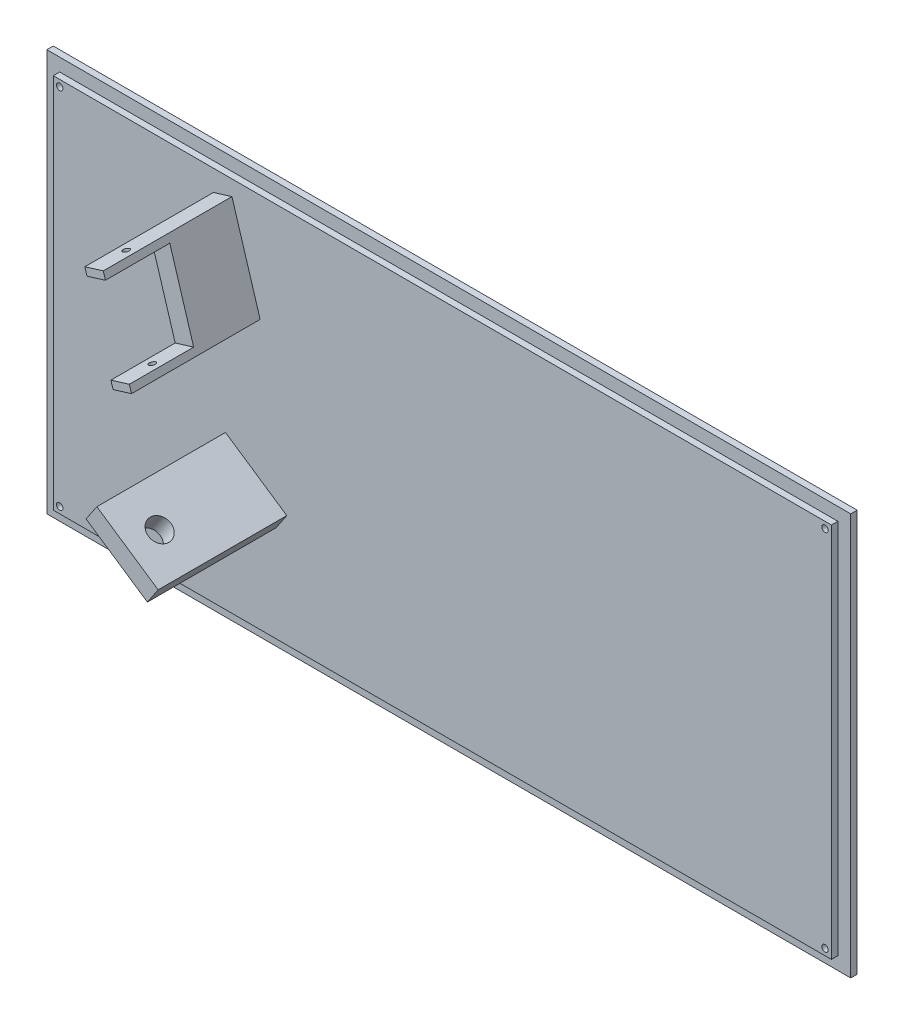
from build123d import *

# Parameters (mm, degrees)
SKIZZE1_W                       = 250
SKIZZE1_H                       = 125
AUFSATZ_LINEAR_AUSTRAGEN1_DEPTH = 2
SKIZZE2_W                       = 242
SKIZZE2_H                       = 117
AUFSATZ_LINEAR_AUSTRAGEN2_DEPTH = 2
SKIZZE3_R                       = 1
SCHNITT_LINEAR_AUSTRAGEN1_DEPTH = 32
AUFSATZ_LINEAR_AUSTRAGEN3_DEPTH = 40
SCHNITT_LINEAR_AUSTRAGEN2_DEPTH = 20
SKIZZE8_R                       = 1
SCHNITT_LINEAR_AUSTRAGEN3_DEPTH = 40
SKIZZE9_R                       = 3.493135661
SCHNITT_LINEAR_AUSTRAGEN4_DEPTH = 20


with BuildPart() as part:
    # Skizze1 → Aufsatz-Linear austragen1 (new body)
    with BuildSketch(Plane.XY):
        with Locations((125, 62.5)):
            Rectangle(SKIZZE1_W, SKIZZE1_H)
    extrude(amount=AUFSATZ_LINEAR_AUSTRAGEN1_DEPTH)

    # Skizze2 → Aufsatz-Linear austragen2 (add)
    with BuildSketch(Plane.XY.offset(2)):
        with Locations((125, 62.5)):
            Rectangle(SKIZZE2_W, SKIZZE2_H)
    extrude(amount=AUFSATZ_LINEAR_AUSTRAGEN2_DEPTH)

    # Skizze3 → Schnitt-Linear austragen1 (cut)
    with BuildSketch(Plane.XY.offset(4)):
        with Locations((6, 119)):
            Circle(SKIZZE3_R)
        with Locations((6, 6)):
            Circle(SKIZZE3_R)
        with Locations((244, 6)):
            Circle(SKIZZE3_R)
        with Locations((244, 119)):
            Circle(SKIZZE3_R)
    extrude(amount=-SCHNITT_LINEAR_AUSTRAGEN1_DEPTH, mode=Mode.SUBTRACT)

    # Skizze4 → Aufsatz-Linear austragen3 (add)
    with BuildSketch(Plane.XY.offset(4)):
        Polygon((62.595258591, 85.778313546), (68.333087126, 87.532543775), (59.561935985, 116.221686454), (53.824107449, 114.467456225), align=None)
        Polygon((54.200560001, 46.732563956), (73.26842417, 33.871127177), (76.623581591, 38.845352612), (57.555717422, 51.706789392), align=None)
    extrude(amount=AUFSATZ_LINEAR_AUSTRAGEN3_DEPTH)

    # Skizze7 → Schnitt-Linear austragen2 (cut)
    with BuildSketch(Plane.XY.offset(44)):
        Polygon((54.49656237, 112.267955287), (60.234390906, 114.022185515), (67.660632206, 89.732044713), (61.92280367, 87.977814485), align=None)
    extrude(amount=-SCHNITT_LINEAR_AUSTRAGEN2_DEPTH, mode=Mode.SUBTRACT)

    # Skizze8 → Schnitt-Linear austragen3 (cut)
    with BuildSketch(Plane(origin=(-27.403744567, 89.633609675, 0), x_dir=(0.9563047559630352, 0.2923717047227376, 0), z_dir=(-0.29237170472273766, 0.9563047559630353, 0))):
        with Locations((87.939295251, -34)):
            Circle(SKIZZE8_R)
    extrude(amount=-SCHNITT_LINEAR_AUSTRAGEN3_DEPTH, mode=Mode.SUBTRACT)

    # Skizze9 → Schnitt-Linear austragen4 (cut)
    with BuildSketch(Plane(origin=(41.968333241, 62.220612777, 0), x_dir=(0.8290375725550413, -0.5591929034707476, 0), z_dir=(0.5591929034707476, 0.8290375725550413, 0))):
        with Locations((30.301782569, -34)):
            Circle(SKIZZE9_R)
    extrude(amount=-SCHNITT_LINEAR_AUSTRAGEN4_DEPTH, mode=Mode.SUBTRACT)


solid = part.part
